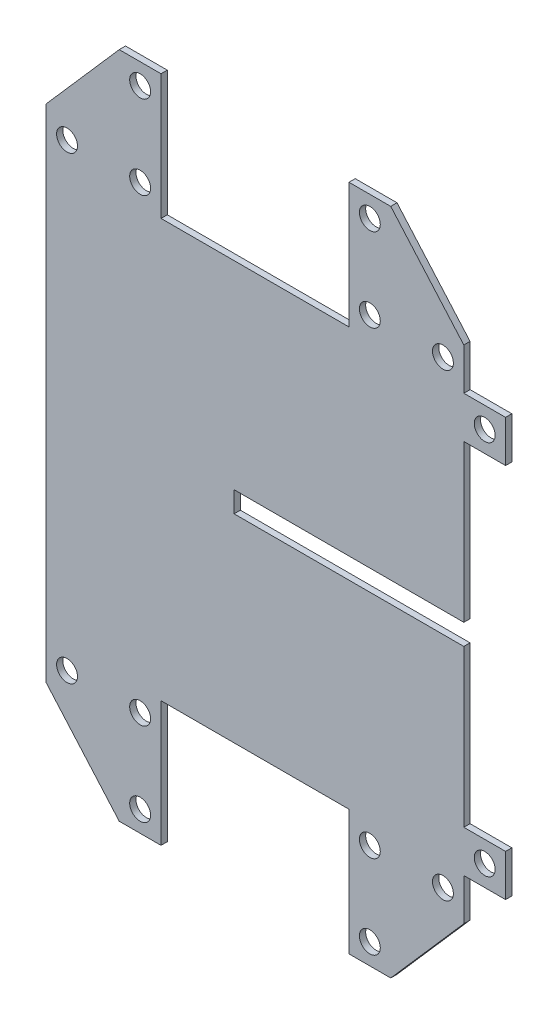
from build123d import *

# Parameters (mm, degrees)
ESQUISSE1_R        = 5
BOSS_EXTRU_1_DEPTH = 3


with BuildPart() as part:
    # Esquisse1 → Boss.-Extru.1 (new body)
    with BuildSketch(Plane.XY):
        Polygon((0, 120), (0, 0), (90, 0), (90, 5), (200, 5), (200, 80), (220, 80), (220, 100), (200, 100), (200, 120), (165, 160), (145, 160), (145, 100), (55, 100), (55, 160), (35, 160), align=None)
        with Locations((10, 110)):
            Circle(ESQUISSE1_R, mode=Mode.SUBTRACT)
        with Locations((45, 110)):
            Circle(ESQUISSE1_R, mode=Mode.SUBTRACT)
        with Locations((45, 150)):
            Circle(ESQUISSE1_R, mode=Mode.SUBTRACT)
        with Locations((155, 150)):
            Circle(ESQUISSE1_R, mode=Mode.SUBTRACT)
        with Locations((155, 110)):
            Circle(ESQUISSE1_R, mode=Mode.SUBTRACT)
        with Locations((190, 110)):
            Circle(ESQUISSE1_R, mode=Mode.SUBTRACT)
        with Locations((210, 90)):
            Circle(ESQUISSE1_R, mode=Mode.SUBTRACT)
    boss_extru_1 = extrude(amount=BOSS_EXTRU_1_DEPTH)

    # Symétrie1: Boss.-Extru.1 across plane
    add(boss_extru_1.mirror(Plane(origin=(0, 0, 3), x_dir=(0, 0, 1), z_dir=(0, 1, 0))))


solid = part.part
